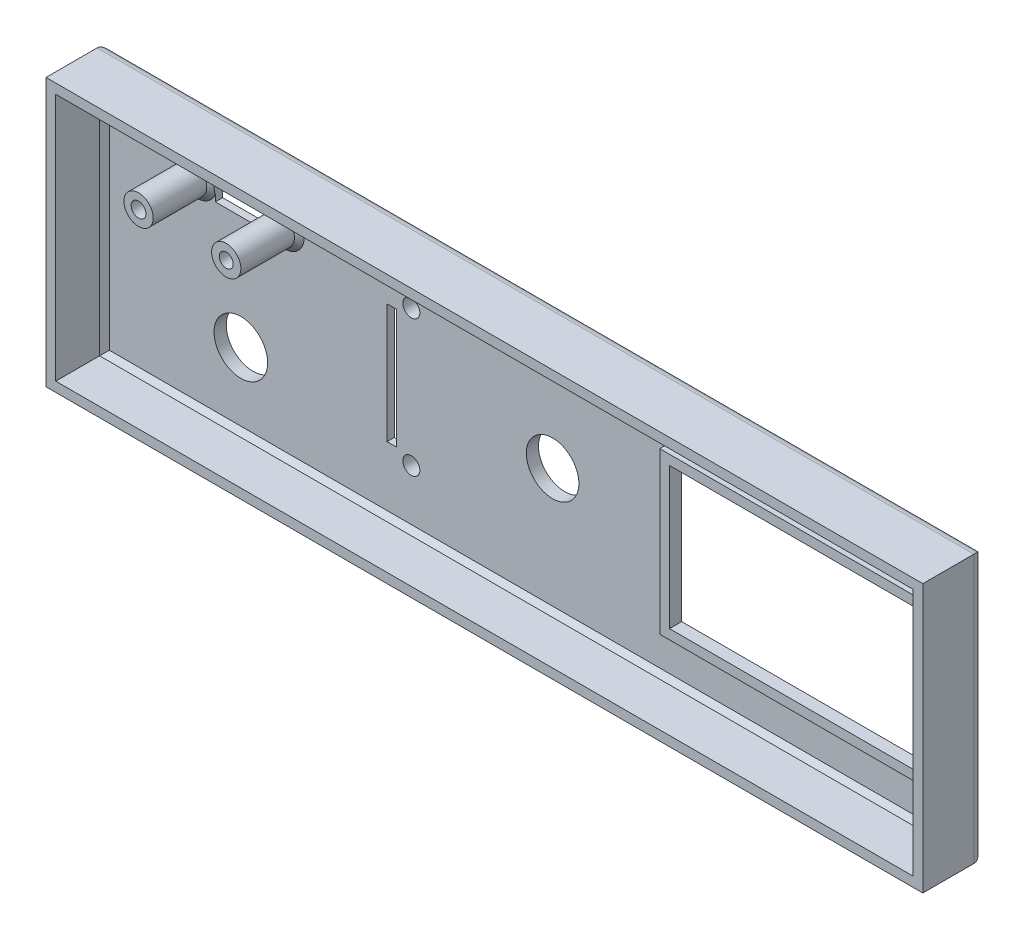
from build123d import *

# Parameters (mm, degrees)
SKETCH_1_W          = 180
SKETCH_1_H          = 55
SKETCH_1_W_2        = 176
SKETCH_1_H_2        = 51
EXTRUDE_1_DEPTH     = 10
SKETCH_4_W          = 180
SKETCH_4_H          = 55
EXTRUDE_2_DEPTH     = 2.5
SKETCH_5_W          = 10.5
SKETCH_5_H          = 5.5
CUT_EXTRUDE_1_DEPTH = 2.5
SKETCH_7_R          = 3
EXTRUDE_3_DEPTH     = 12
SKETCH_8_R          = 1.517316024
SKETCH_8_R_2        = 1.4341078
CUT_EXTRUDE_2_DEPTH = 8
SKETCH_9_R          = 5.5
CUT_EXTRUDE_3_DEPTH = 8
SKETCH_10_R         = 1.75
CUT_EXTRUDE_4_DEPTH = 8
SKETCH_12_W         = 2
SKETCH_12_H         = 24.5
CUT_EXTRUDE_5_DEPTH = 8
SKETCH_13_R         = 5.4
CUT_EXTRUDE_6_DEPTH = 8
SKETCH_15_W         = 50
SKETCH_15_H         = 29
CUT_EXTRUDE_7_DEPTH = 8
SKETCH_16_W         = 54
SKETCH_16_H         = 33
SKETCH_16_W_2       = 50
SKETCH_16_H_2       = 29
EXTRUDE_2_2_DEPTH   = 2
CHAMFER_1_SIZE      = 2
CHAMFER_2_SIZE      = 1
CHAMFER_3_SIZE      = 1
CHAMFER_4_SIZE      = 1
CHAMFER_5_SIZE      = 1
FILLET_1_R          = 2


with BuildPart() as part:
    # Эскиз1 → Вытянуть-Тонкостенный1 (new body)
    with BuildSketch(Plane.XY):
        Rectangle(SKETCH_1_W, SKETCH_1_H)
        Rectangle(SKETCH_1_W_2, SKETCH_1_H_2, mode=Mode.SUBTRACT)
    extrude(amount=EXTRUDE_1_DEPTH)

    # Эскиз4 → Extrude 2 (add)
    with BuildSketch(Plane(origin=(0, 0, 0), x_dir=(-1, 0, 0), z_dir=(0, 0, -1))):
        Rectangle(SKETCH_4_W, SKETCH_4_H)
    extrude(amount=EXTRUDE_2_DEPTH)

    # Эскиз5 → Вырез-Вытянуть1 (cut)
    with BuildSketch(Plane(origin=(0, 0, -2.5), x_dir=(-1, 0, 0), z_dir=(0, 0, -1))):
        with Locations((60, 15.5)):
            Rectangle(SKETCH_5_W, SKETCH_5_H)
    extrude(amount=-CUT_EXTRUDE_1_DEPTH, mode=Mode.SUBTRACT)

    # Эскиз7 → Бобышка-Вытянуть3 (add)
    with BuildSketch(Plane.XY):
        with Locations(Location((-51, 15.5, 0), (0, 0, 180))):
            Circle(SKETCH_7_R)
        with Locations(Location((-69, 15.5, 0), (0, 0, 180))):
            Circle(SKETCH_7_R)
    extrude(amount=EXTRUDE_3_DEPTH)

    # Эскиз8 → Вырез-Вытянуть2 (cut)
    with BuildSketch(Plane.XY.offset(12)):
        with Locations((-69, 15.5)):
            Circle(SKETCH_8_R)
        with Locations((-51, 15.5)):
            Circle(SKETCH_8_R_2)
    extrude(amount=-CUT_EXTRUDE_2_DEPTH, mode=Mode.SUBTRACT)

    # Эскиз9 → Вырез-Вытянуть3 (cut)
    with BuildSketch(Plane(origin=(0, 0, -2.5), x_dir=(-1, 0, 0), z_dir=(0, 0, -1))):
        with Locations((60, -10.5)):
            Circle(SKETCH_9_R)
    extrude(amount=-CUT_EXTRUDE_3_DEPTH, mode=Mode.SUBTRACT)

    # Эскиз10 → Вырез-Вытянуть4 (cut)
    with BuildSketch(Plane(origin=(0, 0, -2.5), x_dir=(-1, 0, 0), z_dir=(0, 0, -1))):
        with Locations((25, 14)):
            Circle(SKETCH_10_R)
        with Locations((25, -14)):
            Circle(SKETCH_10_R)
    extrude(amount=-CUT_EXTRUDE_4_DEPTH, mode=Mode.SUBTRACT)

    # Эскиз12 → Вырез-Вытянуть5 (cut)
    with BuildSketch(Plane(origin=(0, 0, -2.5), x_dir=(-1, 0, 0), z_dir=(0, 0, -1))):
        with Locations((29, 0)):
            Rectangle(SKETCH_12_W, SKETCH_12_H)
    extrude(amount=-CUT_EXTRUDE_5_DEPTH, mode=Mode.SUBTRACT)

    # Эскиз13 → Вырез-Вытянуть6 (cut)
    with BuildSketch(Plane(origin=(0, 0, -2.5), x_dir=(-1, 0, 0), z_dir=(0, 0, -1))):
        with Locations((-4, 0)):
            Circle(SKETCH_13_R)
    extrude(amount=-CUT_EXTRUDE_6_DEPTH, mode=Mode.SUBTRACT)

    # Эскиз15 → Вырез-Вытянуть7 (cut)
    with BuildSketch(Plane(origin=(0, 0, -2.5), x_dir=(-1, 0, 0), z_dir=(0, 0, -1))):
        with Locations((-55, 0)):
            Rectangle(SKETCH_15_W, SKETCH_15_H)
    extrude(amount=-CUT_EXTRUDE_7_DEPTH, mode=Mode.SUBTRACT)

    # Эскиз16 → Extrude 2 2 (add)
    with BuildSketch(Plane.XY):
        with Locations((55, 0)):
            Rectangle(SKETCH_16_W, SKETCH_16_H)
        with Locations((55, 0)):
            Rectangle(SKETCH_16_W_2, SKETCH_16_H_2, mode=Mode.SUBTRACT)
    extrude(amount=EXTRUDE_2_2_DEPTH)

    # Фаска1
    chamfer_1_edges = [part.edges().sort_by_distance(p)[0] for p in [
        (80, 0, -2.5),
        (55, -14.5, -2.5),
        (30, 0, -2.5),
        (55, 14.5, -2.5),
    ]]
    chamfer(chamfer_1_edges, length=CHAMFER_1_SIZE)

    # Фаска2
    chamfer_2_edges = [part.edges().sort_by_distance(p)[0] for p in [
        (-30, 0, -2.5),
        (-29, 12.25, -2.5),
        (-28, 0, -2.5),
        (-29, -12.25, -2.5),
    ]]
    chamfer(chamfer_2_edges, length=CHAMFER_2_SIZE)

    # Фаска3
    chamfer_3_edges = [part.edges().sort_by_distance(p)[0] for p in [
        (-65.25, 15.5, -2.5),
        (-60, 18.25, -2.5),
        (-54.75, 15.5, -2.5),
        (-60, 12.75, -2.5),
    ]]
    chamfer(chamfer_3_edges, length=CHAMFER_3_SIZE)

    # Фаска4
    # the kernel refuses this chamfer: 1 mm, written as the material it adds along each edge
    with BuildSketch(Plane(origin=(-51, 15.5, 0), x_dir=(-1, 0, 0), z_dir=(0, 1, 0))) as chamfer_4_piece_1_section:
        Polygon((3 + CHAMFER_4_SIZE, 0), (3, CHAMFER_4_SIZE), (3, 0), align=None)
    chamfer_4_piece_1 = revolve(axis=Axis((-51, 15.5, 0), (0, 0, 1)), mode=Mode.PRIVATE)
    chamfer_4_piece_1 = split(chamfer_4_piece_1, bisect_by=Plane(origin=(-54.75, 15.5, 0.484065112), z_dir=(1, 0, 0)), keep=Keep.TOP, mode=Mode.PRIVATE)
    add(chamfer_4_piece_1)
    with BuildSketch(Plane(origin=(-69, 15.5, 0), x_dir=(-1, 0, 0), z_dir=(0, 1, 0))) as chamfer_4_piece_2_section:
        Polygon((3 + CHAMFER_4_SIZE, 0), (3, CHAMFER_4_SIZE), (3, 0), align=None)
    chamfer_4_piece_2 = revolve(axis=Axis((-69, 15.5, 0), (0, 0, 1)), mode=Mode.PRIVATE)
    chamfer_4_piece_2 = split(chamfer_4_piece_2, bisect_by=Plane(origin=(-65.25, 15.5, 0.484065116), z_dir=(-1, 0, 0)), keep=Keep.TOP, mode=Mode.PRIVATE)
    add(chamfer_4_piece_2)

    # Фаска5
    chamfer_5_edges = [part.edges().sort_by_distance(p)[0] for p in [
        (88, 0, 0),
        (0, 25.5, 0),
        (-88, 0, 0),
        (0, -25.5, 0),
    ]]
    chamfer(chamfer_5_edges, length=CHAMFER_5_SIZE)

    # Скругление1
    fillet_1_edges = [part.edges().sort_by_distance(p)[0] for p in [
        (-90, 0, -2.5),
        (0, 27.5, -2.5),
        (90, 0, -2.5),
        (0, -27.5, -2.5),
    ]]
    fillet(fillet_1_edges, radius=FILLET_1_R)


solid = part.part
